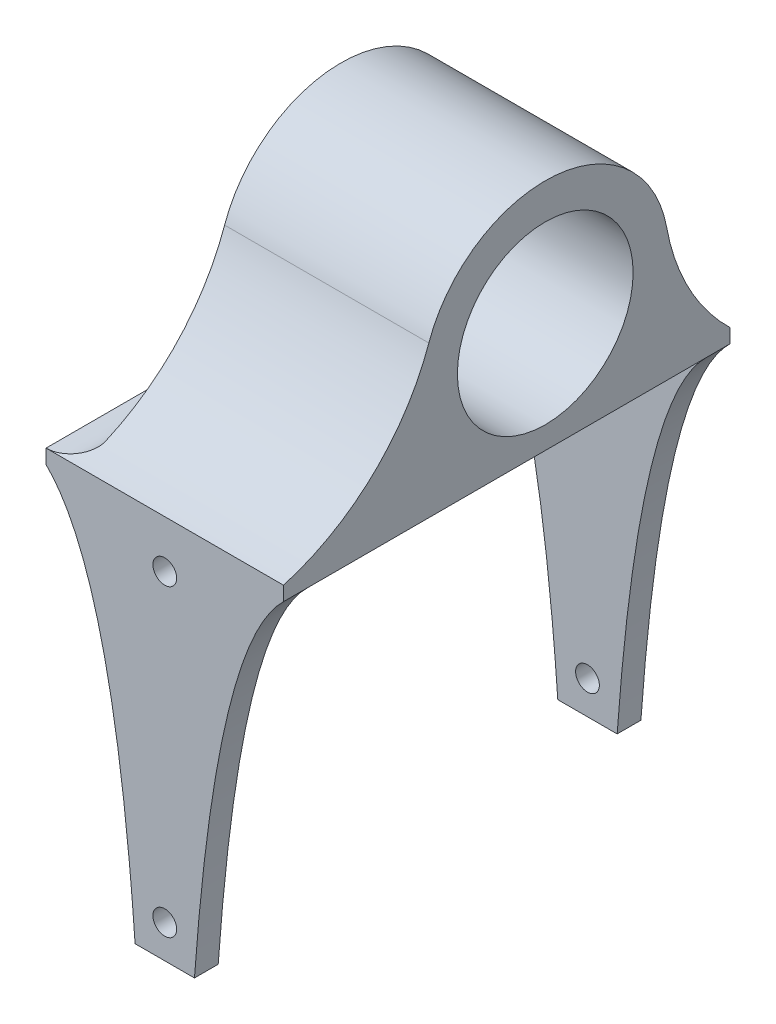
from build123d import *

# Parameters (mm, degrees)
BOSS_EXTRUDE1_DEPTH      = 5
BOSS_EXTRUDE2_START      = -84
BOSS_EXTRUDE2_DEPTH      = 5
BOSS_EXTRUDE7_DEPTH      = 21
BOSS_EXTRUDE7_DEPTH_BACK = 29
BOSS_EXTRUDE7_START      = 4
SKETCH9_W                = 94
SKETCH9_H                = 3
CUT_EXTRUDE1_DEPTH       = 106.948100654
CUT_EXTRUDE1_DEPTH_BACK  = 106.948100654
SKETCH5_R                = 2.5
BOSS_EXTRUDE9_START      = -8.5
SKETCH13_R               = 18.5
BOSS_EXTRUDE9_DEPTH      = 41.5
BOSS_EXTRUDE10_START     = 1.5
SKETCH15_R               = 1.5
SKETCH15_R_2             = 6
BOSS_EXTRUDE10_DEPTH     = 1.5
FILLET2_R                = 46
FILLET4_SIZE             = 2
FILLET4_SIZE_2           = 7


with BuildPart() as part:
    # Sketch2 → Boss-Extrude1 (new body)
    with BuildSketch(Plane.XY):
        with BuildLine():
            Line((6.25, -39), (-6.25, -39))
            add(Edge.make_bspline(
                [(-25, 39), (-10.900418278, 25.328341358), (-6.25, -39)],
                knots=[0, 0, 0, 1, 1, 1], degree=2))
            Line((-25, 39), (25, 39))
            add(Edge.make_bspline(
                [(25, 39), (10.900418278, 25.328341358), (6.25, -39)],
                knots=[0, 0, 0, 1, 1, 1], degree=2))
        make_face()
    extrude(amount=BOSS_EXTRUDE1_DEPTH)



with BuildPart() as body_2:
    # Sketch3 → Boss-Extrude2 (new body)
    with BuildSketch(Plane.XY.offset(BOSS_EXTRUDE2_START)):
        with BuildLine():
            Line((6.25, -39), (-6.25, -39))
            add(Edge.make_bspline(
                [(-25, 39), (-10.900418278, 25.328341358), (-6.25, -39)],
                knots=[0, 0, 0, 1, 1, 1], degree=2))
            Line((-25, 39), (25, 39))
            add(Edge.make_bspline(
                [(25, 39), (10.900418278, 25.328341358), (6.25, -39)],
                knots=[0, 0, 0, 1, 1, 1], degree=2))
        make_face()
    extrude(amount=-BOSS_EXTRUDE2_DEPTH)


with BuildPart() as part_1:
    add(part.part)

    add(body_2.part)  # Boss-Extrude7 merges body 2
    # Sketch9 → Boss-Extrude7 (add, two sides: drawn at the far end of the back side and taken through both)
    with BuildSketch(Plane(origin=(0, 0, 0), x_dir=(0, 0, -1), z_dir=(1, 0, 0)).offset(BOSS_EXTRUDE7_START - BOSS_EXTRUDE7_DEPTH_BACK)):
        with Locations((42, 40.5)):
            Rectangle(SKETCH9_W, SKETCH9_H)
    extrude(amount=BOSS_EXTRUDE7_DEPTH + BOSS_EXTRUDE7_DEPTH_BACK)

    # Sketch5 → Cut-Extrude1 (cut, two sides: drawn at the far end of the back side and taken through both)
    with BuildSketch(Plane.XY.offset(5).offset(-CUT_EXTRUDE1_DEPTH_BACK)):
        with Locations((0, 32)):
            Circle(SKETCH5_R)
        with Locations((0, -32)):
            Circle(SKETCH5_R)
    extrude(amount=CUT_EXTRUDE1_DEPTH + CUT_EXTRUDE1_DEPTH_BACK, mode=Mode.SUBTRACT)

    # Sketch13 → Boss-Extrude9 (add)
    with BuildSketch(Plane.ZY.offset(25).offset(BOSS_EXTRUDE9_START)):
        with BuildLine():
            Line((-66.479483804, 42), (-33.740516196, 42))
            ThreePointArc((-33.740516196, 42), (-50.11, 88.2), (-66.479483804, 42))
        make_face()
        with Locations(Location((-50.11, 62.2, 0), (0, 0, 180))):
            Circle(SKETCH13_R, mode=Mode.SUBTRACT)
    extrude(amount=-BOSS_EXTRUDE9_DEPTH)

    # Sketch15 → Boss-Extrude10 (add)
    with BuildSketch(Plane.ZY.offset(16.5).offset(BOSS_EXTRUDE10_START)):
        with BuildLine():
            Line((-66.479483804, 42), (-33.740516196, 42))
            ThreePointArc((-33.740516196, 42), (-50.11, 88.2), (-66.479483804, 42))
        make_face()
        with Locations((-34.61, 62.2)):
            Circle(SKETCH15_R, mode=Mode.SUBTRACT)
        with Locations((-42.36, 48.776606241)):
            Circle(SKETCH15_R, mode=Mode.SUBTRACT)
        with Locations((-57.86, 48.776606241)):
            Circle(SKETCH15_R, mode=Mode.SUBTRACT)
        with Locations((-65.61, 62.2)):
            Circle(SKETCH15_R, mode=Mode.SUBTRACT)
        with Locations((-57.86, 75.623393759)):
            Circle(SKETCH15_R, mode=Mode.SUBTRACT)
        with Locations((-42.36, 75.623393759)):
            Circle(SKETCH15_R, mode=Mode.SUBTRACT)
        with Locations((-56.172177826, 65.7)):
            Circle(SKETCH15_R_2, mode=Mode.SUBTRACT)
    extrude(amount=-BOSS_EXTRUDE10_DEPTH)

    # Fillet2
    # the kernel refuses this fillet: 46 mm, written as the material it adds along each edge
    with BuildSketch(Plane(origin=(-18, 42, -66.479483804), x_dir=(0, 0, -1), z_dir=(1, 0, 0))) as fillet2_piece_1:
        with BuildLine():
            CenterArc((54.465764785, 33.098354832), FILLET2_R, 190.319893555, 35.695751296)
            Line((9.20991152, 24.857739245), (8.304794455, 24.692926933))
            ThreePointArc((8.304794455, 24.692926933), (7.148225336, 11.486576056), (-0.579227888, 0.714769231))
            Line((-0.579227888, 0.714769231), (0, -0.92))
            ThreePointArc((0, -0.92), (11.260258098, -0.92), (21.881611225, -0.661967097))
            Line((21.881611225, -0.661967097), (22.520516196, 0))
        make_face()
    extrude(amount=43)
    with BuildSketch(Plane(origin=(25, 42, -33.740516196), x_dir=(0, 0, 1), z_dir=(-1, 0, 0))) as fillet2_piece_2:
        with BuildLine():
            CenterArc((51.516198575, 44.19029237), FILLET2_R, 199.46302715, 54.412069486)
            Line((8.144790389, 28.863161134), (7.277362225, 28.556618509))
            ThreePointArc((7.277362225, 28.556618509), (7.767902037, 13.388758941), (-0.579227888, 0.714769231))
            Line((-0.579227888, 0.714769231), (0, -0.92))
            ThreePointArc((0, -0.92), (19.370258098, -0.92), (38.485002549, -0.883805847))
            Line((38.485002549, -0.883805847), (38.740516196, 0))
        make_face()
    extrude(amount=43)

    # Fillet4
    # an asymmetric fillet: 7, 2 mm, written as the material it adds along each edge
    with BuildSketch(Plane(origin=(-18, 42, -89), x_dir=(0, 1, 0), z_dir=(0, 0, 1))) as fillet4_piece_1_section:
        with BuildLine():
            Bezier((FILLET4_SIZE, 0), (0, 0), (0, FILLET4_SIZE_2), weights=[1, 0.707106781, 1])
            Line((0, FILLET4_SIZE_2), (0, 0))
            Line((0, 0), (FILLET4_SIZE, 0))
        make_face()
    fillet4_piece_1 = extrude(amount=94, mode=Mode.PRIVATE)
    fillet4_piece_1 = fillet4_piece_1 - Plane(origin=(-19.911254264, 86.19029237, 17.775682378), x_dir=(0, 0, 1), z_dir=(1, 0, 0)) * Cylinder(46, 216, mode=Mode.PRIVATE)
    fillet4_piece_1 = fillet4_piece_1 - Plane(origin=(-19.911254264, 75.098354832, -120.945248589), x_dir=(0, 0, -1), z_dir=(-1, 0, 0)) * Cylinder(46, 216, mode=Mode.PRIVATE)
    add(fillet4_piece_1)


solid = part_1.part
